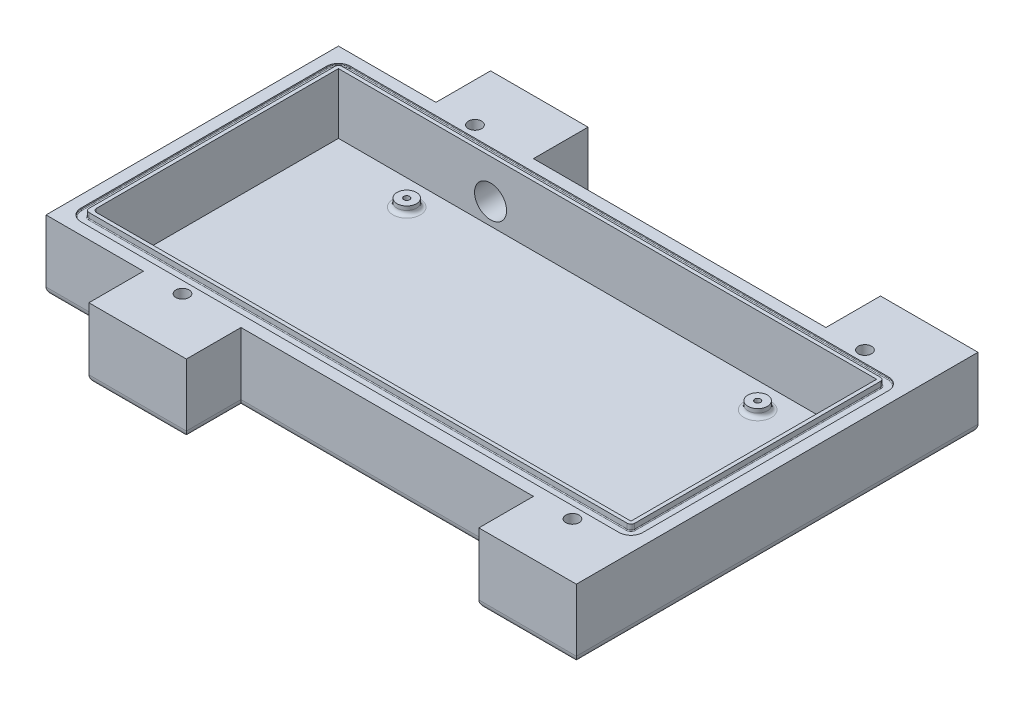
from build123d import *

# Parameters (mm, degrees)
SKETCH1_W                                    = 150
SKETCH1_H                                    = 75
BOSS_EXTRUDE1_DEPTH                          = 18
SKETCH5_W                                    = 138
SKETCH5_H                                    = 63
CUT_EXTRUDE2_DEPTH                           = 14.5
SKETCH2_W                                    = 25
SKETCH2_H                                    = 18
BOSS_EXTRUDE2_DEPTH                          = 14
SKETCH3_R                                    = 4.1
SKETCH7_R                                    = 4.1
CHAMFER3_SIZE                                = 11.342563639
CHAMFER3_SIZE_2                              = 2
FILLET3_R                                    = 2
CHAMFER4_SIZE                                = 11.342563639
CHAMFER4_SIZE_2                              = 2
CBORE_FOR_M3_HEX_HEAD_CAP_SCREW1_D           = 3.4
CBORE_FOR_M3_HEX_HEAD_CAP_SCREW1_CBORE_D     = 9.351
CBORE_FOR_M3_HEX_HEAD_CAP_SCREW1_CBORE_DEPTH = 2
BOSS_EXTRUDE3_START                          = 1
SKETCH19_W                                   = 138
SKETCH19_H                                   = 63
BOSS_EXTRUDE3_DEPTH                          = 1
SKETCH20_R                                   = 2.5
SKETCH20_R_2                                 = 0.75
BOSS_EXTRUDE4_DEPTH                          = 2
FILLET4_R                                    = 1


with BuildPart() as part:
    # Sketch1 → Boss-Extrude1 (new body)
    with BuildSketch(Plane(origin=(0, 0, 0), x_dir=(1, 0, 0), z_dir=(0, 1, 0))):
        with Locations((75, 37.5)):
            Rectangle(SKETCH1_W, SKETCH1_H)
    extrude(amount=BOSS_EXTRUDE1_DEPTH)

    # Sketch5 → Cut-Extrude2 (cut)
    with BuildSketch(Plane(origin=(0, 18, 0), x_dir=(1, 0, 0), z_dir=(0, 1, 0))):
        with Locations((75, 37.5)):
            Rectangle(SKETCH5_W, SKETCH5_H)
    extrude(amount=-CUT_EXTRUDE2_DEPTH, mode=Mode.SUBTRACT)

    # Sketch2 → Boss-Extrude2 (add)
    with BuildSketch(Plane.XY):
        with Locations((137.5, 9)):
            Rectangle(SKETCH2_W, SKETCH2_H)
        with Locations((37.5, 9)):
            Rectangle(SKETCH2_W, SKETCH2_H)
    boss_extrude2 = extrude(amount=BOSS_EXTRUDE2_DEPTH)

    # Cut-Sweep1: sweep along a path in Sketch6
    with BuildLine(Plane(origin=(0, 9, 0), x_dir=(1, 0, 0), z_dir=(0, 1, 0))) as cut_sweep1_path:
        Line((25, -7), (40, -7))
        ThreePointArc((40, -7), (43.535533906, -5.535533906), (45, -2))
        Line((45, -2), (45, 6))
    # Sketch3 → Cut-Sweep1 (sweep, cut)
    with BuildSketch(Plane.ZY.offset(-25)):
        with Locations((7, 9)):
            Circle(SKETCH3_R)
    cut_sweep1 = sweep(path=cut_sweep1_path.line, mode=Mode.SUBTRACT)

    # Cut-Sweep2: sweep along a path in Sketch8
    with BuildLine(Plane(origin=(0, 9, 0), x_dir=(1, 0, 0), z_dir=(0, 1, 0))) as cut_sweep2_path:
        Line((125, -7), (140, -7))
        ThreePointArc((140, -7), (143.535533906, -5.535533906), (145, -2))
        Line((145, -2), (145, 6))
    # Sketch7 → Cut-Sweep2 (sweep, cut)
    with BuildSketch(Plane.ZY.offset(-125)):
        with Locations((7, 9)):
            Circle(SKETCH7_R)
    cut_sweep2 = sweep(path=cut_sweep2_path.line, mode=Mode.SUBTRACT)

    # Chamfer3
    # the kernel refuses this chamfer: 11.342563639, 2 mm, written as the material it takes off along each edge
    with BuildSketch(Plane(origin=(144, 42.450270738, -6), x_dir=(-0.0066825316561019464, 0, -0.9999776716360547), z_dir=(0, -1, 0))) as chamfer3_piece_1_section:
        Polygon((CHAMFER3_SIZE * 0.999977671657, CHAMFER3_SIZE * 0.00668253165624), (-CHAMFER3_SIZE_2 * 0.0066825316561, CHAMFER3_SIZE_2 * 0.999977671636), (0, 0), align=None)
    chamfer3_piece_1 = extrude(amount=66.900541476, mode=Mode.PRIVATE)
    chamfer3_piece_1 = chamfer3_piece_1 & Plane(origin=(145, 9, -9.773182529), x_dir=(1, 0, 0), z_dir=(0, 0, -1)) * Cylinder(4.1, 180, mode=Mode.PRIVATE)
    add(chamfer3_piece_1, mode=Mode.SUBTRACT)

    # Mirror1: Boss-Extrude2, Cut-Sweep1, Cut-Sweep2 across plane
    add(boss_extrude2.mirror(Plane(origin=(0, 0, -37.5), x_dir=(1, 0, 0), z_dir=(0, 0, -1))))
    add(cut_sweep1.mirror(Plane(origin=(0, 0, -37.5), x_dir=(1, 0, 0), z_dir=(0, 0, -1))), mode=Mode.SUBTRACT)
    add(cut_sweep2.mirror(Plane(origin=(0, 0, -37.5), x_dir=(1, 0, 0), z_dir=(0, 0, -1))), mode=Mode.SUBTRACT)

    # Cut-Sweep3: sweep along a path in Sketch10
    with BuildLine(Plane(origin=(0, 18, 0), x_dir=(1, 0, 0), z_dir=(0, 1, 0))) as cut_sweep3_path:
        Line((6, 4), (144, 4))
        ThreePointArc((144, 4), (145.414213562, 4.585786438), (146, 6))
        Line((146, 6), (146, 69))
        ThreePointArc((146, 69), (145.414213562, 70.414213562), (144, 71))
        Line((144, 71), (6, 71))
        ThreePointArc((6, 71), (4.585786438, 70.414213562), (4, 69))
        Line((4, 69), (4, 6))
        ThreePointArc((4, 6), (4.585786438, 4.585786438), (6, 4))
    # Sketch11 → Cut-Sweep3 (sweep, cut)
    with BuildSketch(Plane(origin=(0, 0, -37.5), x_dir=(-1, 0, 0), z_dir=(0, 0, -1))):
        with BuildLine():
            Line((-146.85, 17.5), (-145.15, 17.5))
            ThreePointArc((-145.15, 17.5), (-145.008578644, 17.558578644), (-144.95, 17.7))
            Line((-144.95, 17.7), (-144.95, 18.5))
            Line((-144.95, 18.5), (-147.05, 18.5))
            Line((-147.05, 18.5), (-147.05, 17.7))
            ThreePointArc((-147.05, 17.7), (-146.991421356, 17.558578644), (-146.85, 17.5))
        make_face()
    sweep(path=cut_sweep3_path.line, mode=Mode.SUBTRACT)

    # Fillet3
    fillet3_edges = [part.edges().sort_by_distance(p)[0] for p in [
        (125, 0, 7),
        (137.5, 0, 14),
        (87.5, 0, 0),
        (50, 0, 7),
        (25, 0, 7),
        (37.5, 0, 14),
        (150, 0, -37.5),
        (12.5, 0, 0),
        (0, 0, -37.5),
        (87.5, 0, -75),
        (137.5, 0, -89),
        (125, 0, -82),
        (12.5, 0, -75),
        (37.5, 0, -89),
        (50, 0, -82),
        (25, 0, -82),
    ]]
    fillet(fillet3_edges, radius=FILLET3_R)

    # Chamfer4
    # the kernel refuses this chamfer: 11.342563639, 2 mm, written as the material it takes off along each edge
    with BuildSketch(Plane(origin=(144, 42.450270738, -69), x_dir=(-0.0066825316561019525, 0, 0.9999776716360547), z_dir=(0, -1, 0))) as chamfer4_piece_1_section:
        Polygon((CHAMFER4_SIZE * 0.999977671657, -CHAMFER4_SIZE * 0.00668253165624), (-CHAMFER4_SIZE_2 * 0.0066825316561, -CHAMFER4_SIZE_2 * 0.999977671636), (0, 0), align=None)
    chamfer4_piece_1 = extrude(amount=66.900541476, mode=Mode.PRIVATE)
    chamfer4_piece_1 = chamfer4_piece_1 & Plane(origin=(145, 9, -64.160048401), x_dir=(1, 0, 0), z_dir=(0, 0, 1)) * Cylinder(4.1, 180, mode=Mode.PRIVATE)
    add(chamfer4_piece_1, mode=Mode.SUBTRACT)

    # CBORE for M3 Hex Head Cap Screw1 (through all)
    with Locations(Plane(origin=(0, 0, 0), x_dir=(-1, 0, 0), z_dir=(0, -1, 0))):
        with Locations((-35, 0), (-35, 75), (-135, 75), (-135, 0)):
            CounterBoreHole(CBORE_FOR_M3_HEX_HEAD_CAP_SCREW1_D / 2, CBORE_FOR_M3_HEX_HEAD_CAP_SCREW1_CBORE_D / 2, CBORE_FOR_M3_HEX_HEAD_CAP_SCREW1_CBORE_DEPTH)

    # Sketch19 → Boss-Extrude3 (add)
    with BuildSketch(Plane(origin=(0, 18, 0), x_dir=(1, 0, 0), z_dir=(0, 1, 0)).offset(BOSS_EXTRUDE3_START)):
        with BuildLine():
            Line((144, 69.95), (6, 69.95))
            ThreePointArc((6, 69.95), (5.328248558, 69.671751442), (5.05, 69))
            Line((5.05, 69), (5.05, 6))
            ThreePointArc((5.05, 6), (5.328248558, 5.328248558), (6, 5.05))
            Line((6, 5.05), (144, 5.05))
            ThreePointArc((144, 5.05), (144.671751442, 5.328248558), (144.95, 6))
            Line((144.95, 6), (144.95, 69))
            ThreePointArc((144.95, 69), (144.671751442, 69.671751442), (144, 69.95))
        make_face()
        with Locations((75, 37.5)):
            Rectangle(SKETCH19_W, SKETCH19_H, mode=Mode.SUBTRACT)
    extrude(amount=-BOSS_EXTRUDE3_DEPTH)

    # Sketch20 → Boss-Extrude4 (add)
    # profile 1 of 4: a face of its own
    with BuildSketch(Plane(origin=(0, 3.5, 0), x_dir=(1, 0, 0), z_dir=(0, 1, 0))):
        with Locations(Location((120, 62.5, 0), (0, 0, 270))):
            Circle(SKETCH20_R)
        with Locations(Location((120, 62.5, 0), (0, 0, 270))):
            Circle(SKETCH20_R_2, mode=Mode.SUBTRACT)
    # profile 2 of 4: a face of its own
    with BuildSketch(Plane(origin=(0, 3.5, 0), x_dir=(1, 0, 0), z_dir=(0, 1, 0))):
        with Locations(Location((120, 12.5, 0), (0, 0, 270))):
            Circle(SKETCH20_R)
        with Locations(Location((120, 12.5, 0), (0, 0, 270))):
            Circle(SKETCH20_R_2, mode=Mode.SUBTRACT)
    # profile 3 of 4: a face of its own
    with BuildSketch(Plane(origin=(0, 3.5, 0), x_dir=(1, 0, 0), z_dir=(0, 1, 0))):
        with Locations(Location((30, 12.5, 0), (0, 0, 270))):
            Circle(SKETCH20_R)
        with Locations(Location((30, 12.5, 0), (0, 0, 270))):
            Circle(SKETCH20_R_2, mode=Mode.SUBTRACT)
    # profile 4 of 4: a face of its own
    with BuildSketch(Plane(origin=(0, 3.5, 0), x_dir=(1, 0, 0), z_dir=(0, 1, 0))):
        with Locations(Location((30, 62.5, 0), (0, 0, 270))):
            Circle(SKETCH20_R)
        with Locations(Location((30, 62.5, 0), (0, 0, 270))):
            Circle(SKETCH20_R_2, mode=Mode.SUBTRACT)
    extrude(amount=BOSS_EXTRUDE4_DEPTH)

    # Fillet4
    fillet4_edges = [part.edges().sort_by_distance(p)[0] for p in [
        (6, 11.25, -6),
        (120, 3.5, -65),
        (120, 3.5, -15),
        (30, 3.5, -15),
        (30, 3.5, -65),
    ]]
    fillet(fillet4_edges, radius=FILLET4_R)


solid = part.part
